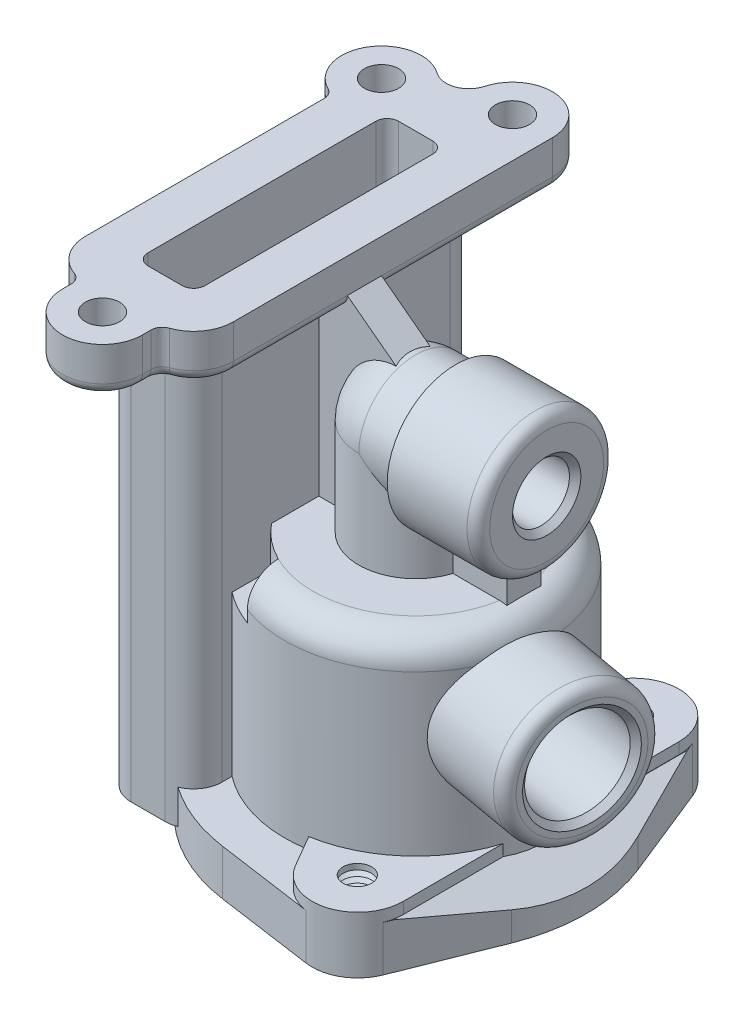
from build123d import *

# Parameters (mm, degrees)
EXTRUDE_1_DEPTH          = 8
EXTRUDE_2_DEPTH          = 2
CUT_EXTRUDE_2_DEPTH      = 86.073807982
CUT_EXTRUDE_2_DEPTH_BACK = 86.073807982
EXTRUDE_3_REACH          = 80.623
EXTRUDE_4_DEPTH          = 80
EXTRUDE_5_DEPTH          = 8
CUT_EXTRUDE_3_DEPTH      = 77
SKETCH_18_R              = 5
CUT_EXTRUDE_4_DEPTH      = 23
CHAMFER_1_SIZE           = 1
SKETCH_19_R              = 8
CUT_EXTRUDE_5_DEPTH      = 36
CHAMFER_2_SIZE           = 1
EXTRUDE_6_DEPTH          = 10
EXTRUDE_6_DEPTH_BACK     = 3
CUT_EXTRUDE_6_DEPTH      = 10
CUT_EXTRUDE_7_DEPTH      = 7
RIB_1_REACH              = 101.619
SKETCH_23_WALL_W         = 211.268706026
SKETCH_23_WALL_H         = 6
RIB_2_REACH              = 101.619
SKETCH_24_WALL_W         = 206.238550486
SKETCH_24_WALL_H         = 6
SKETCH_25_R              = 3
CUT_EXTRUDE_8_DEPTH      = 100.619275243
PATTERN_CIRCULAR_1_COUNT = 3
FILLET_1_R               = 2
FILLET_2_R               = 2
FILLET_10_R              = 5
FILLET_11_R              = 2


with BuildPart() as part:
    # 草圖1 → 伸長1 (new body)
    with BuildSketch(Plane(origin=(0, 0, 0), x_dir=(1, 0, 0), z_dir=(0, 1, 0))):
        with BuildLine():
            Line((-34.294311799, 4.888780854), (-23.603829643, 18.516458252))
            ThreePointArc((-23.603829643, 18.516458252), (-15.045388996, 25.954503847), (-4.337607065, 29.684763178))
            Line((-4.337607065, 29.684763178), (12.800898947, 32.189081785))
            ThreePointArc((12.800898947, 32.189081785), (17.945478211, 31.208329205), (21.380964312, 27.255354796))
            Line((21.380964312, 27.255354796), (27.837638056, 11.183286971))
            ThreePointArc((27.837638056, 11.183286971), (29.999954172, 0.052437157), (27.87656255, -11.085903679))
            Line((27.87656255, -11.085903679), (21.476113077, -27.180444572))
            ThreePointArc((21.476113077, -27.180444572), (18.054466796, -31.145404616), (12.913347487, -32.14413565))
            Line((12.913347487, -32.14413565), (-4.233808413, -29.699745223))
            ThreePointArc((-4.233808413, -29.699745223), (-14.954565176, -26.006941004), (-23.538955485, -18.598859499))
            Line((-23.538955485, -18.598859499), (-34.277012024, -5.008637213))
            ThreePointArc((-34.277012024, -5.008637213), (-35.999945007, -0.062924589), (-34.294311799, 4.888780854))
        make_face()
    extrude(amount=EXTRUDE_1_DEPTH)

    # 草圖2 → 旋轉1 (revolve)
    with BuildSketch(Plane.XY, mode=Mode.PRIVATE) as revolve_1_sk:
        with BuildLine():
            Line((10, 60), (10, 43))
            Line((10, 43), (23, 43))
            Line((23, 43), (23, 0))
            Line((23, 0), (0, 0))
            Line((0, 0), (0, 70))
            ThreePointArc((0, 70), (7.071067812, 67.071067812), (10, 60))
        make_face()
    revolve(revolve_1_sk.sketch.rotate(Axis((0, -12.299634449, 0), (0, 1, 0)), 90), axis=Axis((0, -12.299634449, 0), (0, 1, 0)))

    # 草圖5 → 伸長2 (add)
    with BuildSketch(Plane(origin=(0, 8, 0), x_dir=(-1, 0, 0), z_dir=(0, 1, 0))):
        with BuildLine():
            ThreePointArc((-3.893353697, 22.668078811), (-15.223471322, 17.240821352), (-22.011679547, 6.66977987))
            Line((-22.011679547, 6.66977987), (-21.988228798, -6.746687657))
            ThreePointArc((-21.988228798, -6.746687657), (-15.16310775, -17.293934294), (-3.814086721, -22.681550707))
            Line((-3.814086721, -22.681550707), (9.237590196, 0.016146457))
            Line((9.237590196, 0.016146457), (-3.893353697, 22.668078811))
        make_face()
        with BuildLine():
            ThreePointArc((-3.814086721, -22.681550707), (-15.16310775, -17.293934294), (-21.988228798, -6.746687657))
            Line((-21.988228798, -6.746687657), (-21.957594164, -24.273144937))
            ThreePointArc((-21.957594164, -24.273144937), (-21.81211392, -25.79186789), (-21.380964312, -27.255354796))
            ThreePointArc((-21.380964312, -27.255354796), (-17.945478211, -31.208329205), (-12.800898947, -32.189081785))
            ThreePointArc((-12.800898947, -32.189081785), (-9.460147322, -30.889259499), (-7.022409896, -28.261028984))
            Line((-7.022409896, -28.261028984), (-3.814086721, -22.681550707))
        make_face()
        with BuildLine():
            Line((-22.042363063, 24.224203591), (-22.042314181, 24.196237149))
            Line((-22.042314181, 24.196237149), (-22.011679547, 6.66977987))
            ThreePointArc((-22.011679547, 6.66977987), (-15.223471322, 17.240821352), (-3.893353697, 22.668078811))
            Line((-3.893353697, 22.668078811), (-7.121162037, 28.236307323))
            ThreePointArc((-7.121162037, 28.236307323), (-9.568072349, 30.855999924), (-12.913347487, 32.14413565))
            ThreePointArc((-12.913347487, 32.14413565), (-18.054466796, 31.145404616), (-21.476113077, 27.180444572))
            ThreePointArc((-21.476113077, 27.180444572), (-21.899525404, 25.729195267), (-22.042363063, 24.224203591))
        make_face()
    extrude(amount=EXTRUDE_2_DEPTH)

    # 草圖6 → 除料-伸長2 (cut, two sides: drawn at the far end of the back side and taken through both)
    with BuildSketch(Plane.XY.offset(-CUT_EXTRUDE_2_DEPTH_BACK)):
        Polygon((22.011679547, 8), (30, 4), (30, 8), align=None)
    extrude(amount=CUT_EXTRUDE_2_DEPTH + CUT_EXTRUDE_2_DEPTH_BACK, mode=Mode.SUBTRACT)

    # 草圖7 → 伸長3 (add, up to next)
    with BuildSketch(Plane.XZ.offset(-8), mode=Mode.PRIVATE) as extrude_3_sk1:
        with BuildLine():
            Line((22.011679547, 6.66977987), (22.011679547, -6.66977987))
            ThreePointArc((22.011679547, -6.66977987), (23, 0), (22.011679547, 6.66977987))
        make_face()
    extrude_3_tool1 = extrude(extrude_3_sk1.sketch, amount=EXTRUDE_3_REACH, mode=Mode.PRIVATE) - part.part
    add(extrude_3_tool1.solids().sort_by_distance((22.407745, 8, 0))[0])

    # 草圖8 → 旋轉2 (revolve)
    with BuildSketch(Plane.XY, mode=Mode.PRIVATE) as revolve_2_sk:
        Polygon((0, 60), (0, 70), (7, 70), (7, 72), (23, 72), (23, 60), (7, 60), align=None)
    revolve(revolve_2_sk.sketch.rotate(Axis((0, 60, 0), (1, 0, 0)), 90), axis=Axis((0, 60, 0), (1, 0, 0)))

    # 草圖9 → 旋轉3 (revolve)
    with BuildSketch(Plane(origin=(0, 28, 0), x_dir=(-1, 0, 0), z_dir=(0, 1, 0))):
        Polygon((-33.369300976, 18.069027432), (-35.453079108, 6.251334396), (0, 0), (2.083778132, 11.817693036), align=None)
    revolve(axis=Axis((0, 28, 0), (0.984807753012208, 0, 0.17364817766693058)))

    # 草圖10 → 伸長4 (add)
    with BuildSketch(Plane(origin=(0, 82, 0), x_dir=(-1, 0, 0), z_dir=(0, 1, 0))):
        with BuildLine():
            Line((25, -25), (19, -25))
            ThreePointArc((19, -25), (15.464466094, -23.535533906), (14, -20))
            Line((14, -20), (14, 20))
            ThreePointArc((14, 20), (15.464466094, 23.535533906), (19, 25))
            Line((19, 25), (25, 25))
            ThreePointArc((25, 25), (28.535533906, 23.535533906), (30, 20))
            Line((30, 20), (30, -20))
            ThreePointArc((30, -20), (28.535533906, -23.535533906), (25, -25))
        make_face()
    extrude(amount=-EXTRUDE_4_DEPTH)

    # 草圖11 → 伸長5 (add)
    with BuildSketch(Plane(origin=(0, 82, 0), x_dir=(-1, 0, 0), z_dir=(0, 1, 0))):
        with BuildLine():
            Line((9, -33), (9, 23))
            ThreePointArc((9, 23), (10.284523934, 27.041451884), (13.666666667, 29.599663291))
            ThreePointArc((13.666666667, 29.599663291), (14.632993162, 30.330580836), (15, 31.485281374))
            Line((15, 31.485281374), (15, 33))
            ThreePointArc((15, 33), (22, 40), (29, 33))
            Line((29, 33), (29, 31.485281374))
            ThreePointArc((29, 31.485281374), (29.367006838, 30.330580836), (30.333333333, 29.599663291))
            ThreePointArc((30.333333333, 29.599663291), (33.715476066, 27.041451884), (35, 23))
            Line((35, 23), (35, -18.937742252))
            ThreePointArc((35, -18.937742252), (35.300326829, -19.991834805), (36.111111111, -20.729355085))
            ThreePointArc((36.111111111, -20.729355085), (39.000898161, -30.604056223), (28.926223364, -32.69248135))
            ThreePointArc((28.926223364, -32.69248135), (25.26707053, -32.173366502), (22.744405182, -34.874299532))
            ThreePointArc((22.744405182, -34.874299532), (15.054176622, -39.935806957), (9, -33))
        make_face()
    extrude(amount=-EXTRUDE_5_DEPTH)

    # 草圖12 → 除料-伸長3 (cut)
    with BuildSketch(Plane(origin=(0, 82, 0), x_dir=(-1, 0, 0), z_dir=(0, 1, 0))):
        with BuildLine():
            Line((27, -20), (27, 20))
            ThreePointArc((27, 20), (26.414213562, 21.414213562), (25, 22))
            Line((25, 22), (19, 22))
            ThreePointArc((19, 22), (17.585786438, 21.414213562), (17, 20))
            Line((17, 20), (17, -20))
            ThreePointArc((17, -20), (17.585786438, -21.414213562), (19, -22))
            Line((19, -22), (25, -22))
            ThreePointArc((25, -22), (26.414213562, -21.414213562), (27, -20))
        make_face()
    extrude(amount=-CUT_EXTRUDE_3_DEPTH, mode=Mode.SUBTRACT)

    # 草圖15 → 旋轉4 (revolve)
    with BuildSketch(Plane.XY):
        with BuildLine():
            Line((-35.999957228, 8), (-35.999957228, 0))
            Line((-35.999957228, 0), (-27.999957228, 0))
            Line((-27.999957228, 0), (-27.999957228, 18))
            ThreePointArc((-27.999957228, 18), (-33.656811477, 15.656854249), (-35.999957228, 10))
            Line((-35.999957228, 10), (-35.999957228, 8))
        make_face()
    revolve(axis=Axis((-27.999957228, 10, 0), (0, -1, 0)))

    # 草圖16 → 除料-旋轉2 (revolve, cut)
    with BuildSketch(Plane.XY, mode=Mode.PRIVATE) as cut_revolve_2_sk:
        with BuildLine():
            Line((7, 60), (7, 40))
            Line((7, 40), (20, 40))
            Line((20, 40), (20, 1))
            Line((20, 1), (24, 1))
            Line((24, 1), (24, 0))
            Line((24, 0), (0, 0))
            Line((0, 0), (0, 67))
            ThreePointArc((0, 67), (4.949747468, 64.949747468), (7, 60))
        make_face()
    revolve(cut_revolve_2_sk.sketch.rotate(Axis((0, -12.093798165, 0), (0, 1, 0)), 90), axis=Axis((0, -12.093798165, 0), (0, 1, 0)), mode=Mode.SUBTRACT)

    # 草圖18 → 除料-伸長4 (cut)
    with BuildSketch(Plane(origin=(23, 0, 0), x_dir=(0, 0, -1), z_dir=(1, 0, 0))):
        with Locations((0, 60)):
            Circle(SKETCH_18_R)
    extrude(amount=-CUT_EXTRUDE_4_DEPTH, mode=Mode.SUBTRACT)

    # 導角1
    chamfer_1_edges = [part.edges().sort_by_distance(p)[0] for p in [
        (23, 60, 5),
    ]]
    chamfer(chamfer_1_edges, length=CHAMFER_1_SIZE)

    # 草圖19 → 除料-伸長5 (cut)
    with BuildSketch(Plane(origin=(35.453079108, 0, 6.251334396), x_dir=(0.17364817766693064, 0, -0.9848077530122081), z_dir=(0.9848077530122081, 0, 0.17364817766693064))):
        with Locations((0, 28)):
            Circle(SKETCH_19_R)
    extrude(amount=-CUT_EXTRUDE_5_DEPTH, mode=Mode.SUBTRACT)

    # 導角2
    chamfer_2_edges = [part.edges().sort_by_distance(p)[0] for p in [
        (34.063893687, 28, 14.12979642),
    ]]
    chamfer(chamfer_2_edges, length=CHAMFER_2_SIZE)

    # 草圖20 → 伸長6 (add, two sides: drawn at the far end of the back side and taken through both)
    with BuildSketch(Plane.XZ.offset(-40).offset(-EXTRUDE_6_DEPTH_BACK)):
        with BuildLine():
            Line((-6, 19.078784028), (-6, 13.747727085))
            ThreePointArc((-6, 13.747727085), (-15, 0), (-6, -13.747727085))
            Line((-6, -13.747727085), (-6, -19.078784028))
            ThreePointArc((-6, -19.078784028), (-20, 0), (-6, 19.078784028))
        make_face()
    extrude(amount=EXTRUDE_6_DEPTH + EXTRUDE_6_DEPTH_BACK)

    # 草圖21 → 除料-伸長6 (cut)
    with BuildSketch(Plane(origin=(0, 43, 0), x_dir=(-1, 0, 0), z_dir=(0, 1, 0))):
        with BuildLine():
            Line((17, 10.535653753), (17, 5.916079783))
            ThreePointArc((17, 5.916079783), (18, 0), (17, -5.916079783))
            Line((17, -5.916079783), (17, -10.535653753))
            ThreePointArc((17, -10.535653753), (20, 0), (17, 10.535653753))
        make_face()
    extrude(amount=-CUT_EXTRUDE_6_DEPTH, mode=Mode.SUBTRACT)

    # 草圖22 → 除料-伸長7 (cut)
    with BuildSketch(Plane(origin=(0, 43, 0), x_dir=(-1, 0, 0), z_dir=(0, 1, 0))):
        with BuildLine():
            Line((14, 18.248287591), (14, 11.313708499))
            ThreePointArc((14, 11.313708499), (11.259927442, 14.043291424), (8, 16.124515497))
            Line((8, 16.124515497), (8, 21.563858653))
            ThreePointArc((8, 21.563858653), (11.124219203, 20.130865534), (14, 18.248287591))
        make_face()
        with BuildLine():
            Line((8, -21.563858653), (8, -16.124515497))
            ThreePointArc((8, -16.124515497), (11.259927442, -14.043291424), (14, -11.313708499))
            Line((14, -11.313708499), (14, -18.248287591))
            ThreePointArc((14, -18.248287591), (11.124219203, -20.130865534), (8, -21.563858653))
        make_face()
    extrude(amount=-CUT_EXTRUDE_7_DEPTH, mode=Mode.SUBTRACT)

    # 草圖23 wall → 肋材1 (add, up to next)
    with BuildSketch(Plane(origin=(-5, 72.974937186, 0), x_dir=(0.7975948099, -0.603193600116, 0), z_dir=(0.603193600116, 0.7975948099, 0)), mode=Mode.PRIVATE) as rib_1_sk1:
        Rectangle(SKETCH_23_WALL_W, SKETCH_23_WALL_H)
    rib_1_tool1 = extrude(rib_1_sk1.sketch, amount=-RIB_1_REACH, mode=Mode.PRIVATE) - part.part
    add(rib_1_tool1.solids().sort_by_distance((-5, 72.974937186, 0))[0])

    # 草圖24 wall → 肋材2 (add, up to next)
    with BuildSketch(Plane(origin=(19, 45.5, 0), x_dir=(0, -1, 0), z_dir=(1, 0, 0)), mode=Mode.PRIVATE) as rib_2_sk1:
        Rectangle(SKETCH_24_WALL_W, SKETCH_24_WALL_H)
    rib_2_tool1 = extrude(rib_2_sk1.sketch, amount=-RIB_2_REACH, mode=Mode.PRIVATE) - part.part
    add(rib_2_tool1.solids().sort_by_distance((19, 45.5, 0))[0])

    # 草圖25 → 除料-伸長8 (cut, through all)
    with BuildSketch(Plane(origin=(0, 82, 0), x_dir=(-1, 0, 0), z_dir=(0, 1, 0))):
        with Locations(Location((16, -33, 0), (0, 0, 90))):
            Circle(SKETCH_25_R)
        with Locations(Location((33, -27, 0), (0, 0, 90))):
            Circle(SKETCH_25_R)
        with Locations(Location((22, 33, 0), (0, 0, 90))):
            Circle(SKETCH_25_R)
    extrude(amount=-CUT_EXTRUDE_8_DEPTH, mode=Mode.SUBTRACT)

    # 草圖26 → 除料-旋轉3 (revolve, cut)
    with BuildSketch(Plane.XY, mode=Mode.PRIVATE) as cut_revolve_3_sk:
        Polygon((-30.499957228, 0), (-31.365982631, 0.5), (-30.499957228, 1), (-31.365982631, 1.5), (-30.499957228, 2), (-31.365982631, 2.5), (-30.499957228, 3), (-31.365982631, 3.5), (-30.499957228, 4), (-31.365982631, 4.5), (-30.499957228, 5), (-31.365982631, 5.5), (-30.499957228, 6), (-31.365982631, 6.5), (-30.499957228, 7), (-31.365982631, 7.5), (-30.499957228, 8), (-31.365982631, 8.5), (-30.499957228, 9), (-30.499957228, 12), (-27.999957228, 13.443375673), (-27.999957228, 0), align=None)
    cut_revolve_3 = revolve(cut_revolve_3_sk.sketch.rotate(Axis((-27.999957228, 19.582075994, 0), (0, -1, 0)), 270), axis=Axis((-27.999957228, 19.582075994, 0), (0, -1, 0)), mode=Mode.SUBTRACT)

    # 環狀複製排列1: 除料-旋轉3 ×3 about axis
    pattern_circular_1_axis = Axis((0, 0, 0), (0, 1, 0))
    for i in range(1, PATTERN_CIRCULAR_1_COUNT):
        add(cut_revolve_3.rotate(pattern_circular_1_axis, i * 360 / PATTERN_CIRCULAR_1_COUNT), mode=Mode.SUBTRACT)

    # 圓角1
    fillet_1_edges = [part.edges().sort_by_distance(p)[0] for p in [
        (23, 60, -12),
    ]]
    fillet(fillet_1_edges, radius=FILLET_1_R)

    # 圓角2
    fillet_2_edges = [part.edges().sort_by_distance(p)[0] for p in [
        (37.53685724, 28, -5.56635864),
    ]]
    fillet(fillet_2_edges, radius=FILLET_2_R)

    # 圓角10
    # the kernel refuses this fillet: 5 mm, written as the material it takes off along each edge
    with BuildSketch(Plane(origin=(0, 43, 0), x_dir=(-0.7832105432631083, 0, 0.621756580119187), z_dir=(-0.621756580119187, 0, -0.7832105432631083))) as fillet_10_piece_1_section:
        with BuildLine():
            CenterArc((23 - FILLET_10_R, -FILLET_10_R), FILLET_10_R, 0, 90)
            Line((23 - FILLET_10_R, 0), (23, 0))
            Line((23, 0), (23, -FILLET_10_R))
        make_face()
    fillet_10_piece_1 = revolve(axis=Axis((0, 43, 0), (0, 1, 0)), revolution_arc=231.555476966, mode=Mode.PRIVATE)
    fillet_10_piece_1 = split(fillet_10_piece_1, bisect_by=Plane(origin=(-14, 41.57977262, 20.845930226), z_dir=(1, 0, 0)), keep=Keep.TOP, mode=Mode.PRIVATE)
    fillet_10_piece_1 = split(fillet_10_piece_1, bisect_by=Plane(origin=(5.579765171, 41.57977262, 3), z_dir=(0, 0, 1)), keep=Keep.TOP, mode=Mode.PRIVATE)
    fillet_10_piece_1 = split(fillet_10_piece_1, bisect_by=Plane(origin=(19, 41.57977262, 20.845930226), z_dir=(-1, 0, 0)), keep=Keep.TOP, mode=Mode.PRIVATE)
    add(fillet_10_piece_1, mode=Mode.SUBTRACT)
    with BuildSketch(Plane(origin=(0, 43, 0), x_dir=(-0.7832105432631083, 0, 0.621756580119187), z_dir=(-0.621756580119187, 0, -0.7832105432631083))) as fillet_10_piece_2_section:
        with BuildLine():
            CenterArc((23 - FILLET_10_R, -FILLET_10_R), FILLET_10_R, 0, 90)
            Line((23 - FILLET_10_R, 0), (23, 0))
            Line((23, 0), (23, -FILLET_10_R))
        make_face()
    fillet_10_piece_2 = revolve(axis=Axis((0, 43, 0), (0, 1, 0)), revolution_arc=231.555476966, mode=Mode.PRIVATE)
    fillet_10_piece_2 = fillet_10_piece_2 - Plane(origin=(21.382106569, 28, 3.770242293), x_dir=(-0.17364817766693058, 0, 0.984807753012208), z_dir=(0.984807753012208, 0, 0.17364817766693058)) * Cylinder(12, 92, mode=Mode.PRIVATE)
    fillet_10_piece_2 = split(fillet_10_piece_2, bisect_by=Plane(origin=(20.741195984, 41.778142851, 3), z_dir=(0, 0, 1)), keep=Keep.TOP, mode=Mode.PRIVATE)
    fillet_10_piece_2 = split(fillet_10_piece_2, bisect_by=Plane(origin=(19, 41.778142851, 7.405026841), z_dir=(1, 0, 0)), keep=Keep.TOP, mode=Mode.PRIVATE)
    add(fillet_10_piece_2, mode=Mode.SUBTRACT)
    with BuildSketch(Plane(origin=(0, 43, 0), x_dir=(-0.7832105432631083, 0, 0.621756580119187), z_dir=(-0.621756580119187, 0, -0.7832105432631083))) as fillet_10_piece_3_section:
        with BuildLine():
            CenterArc((23 - FILLET_10_R, -FILLET_10_R), FILLET_10_R, 0, 90)
            Line((23 - FILLET_10_R, 0), (23, 0))
            Line((23, 0), (23, -FILLET_10_R))
        make_face()
    fillet_10_piece_3 = revolve(axis=Axis((0, 43, 0), (0, 1, 0)), revolution_arc=231.555476966, mode=Mode.PRIVATE)
    fillet_10_piece_3 = split(fillet_10_piece_3, bisect_by=Plane(origin=(19, 41.572928891, -16.400836557), z_dir=(-1, 0, 0)), keep=Keep.TOP, mode=Mode.PRIVATE)
    fillet_10_piece_3 = split(fillet_10_piece_3, bisect_by=Plane(origin=(14.014414764, 41.572928891, -3), z_dir=(0, 0, -1)), keep=Keep.TOP, mode=Mode.PRIVATE)
    add(fillet_10_piece_3, mode=Mode.SUBTRACT)
    with BuildSketch(Plane(origin=(0, 43, 0), x_dir=(-0.7832105432631083, 0, 0.621756580119187), z_dir=(-0.621756580119187, 0, -0.7832105432631083))) as fillet_10_piece_4_section:
        with BuildLine():
            CenterArc((23 - FILLET_10_R, -FILLET_10_R), FILLET_10_R, 0, 90)
            Line((23 - FILLET_10_R, 0), (23, 0))
            Line((23, 0), (23, -FILLET_10_R))
        make_face()
    fillet_10_piece_4 = revolve(axis=Axis((0, 43, 0), (0, 1, 0)), revolution_arc=231.555476966, mode=Mode.PRIVATE)
    fillet_10_piece_4 = fillet_10_piece_4 - Plane(origin=(21.174498314, 28, 3.733635356), x_dir=(-0.17364817766693058, 0, 0.984807753012208), z_dir=(0.984807753012208, 0, 0.17364817766693058)) * Cylinder(12, 92, mode=Mode.PRIVATE)
    fillet_10_piece_4 = split(fillet_10_piece_4, bisect_by=Plane(origin=(21.84029198, 41.942478742, 3), z_dir=(0, 0, -1)), keep=Keep.TOP, mode=Mode.PRIVATE)
    fillet_10_piece_4 = split(fillet_10_piece_4, bisect_by=Plane(origin=(19, 41.942478742, -0.042268155), z_dir=(1, 0, 0)), keep=Keep.TOP, mode=Mode.PRIVATE)
    fillet_10_piece_4 = split(fillet_10_piece_4, bisect_by=Plane(origin=(21.84029198, 41.942478742, -3), z_dir=(0, 0, 1)), keep=Keep.TOP, mode=Mode.PRIVATE)
    add(fillet_10_piece_4, mode=Mode.SUBTRACT)
    with BuildSketch(Plane(origin=(0, 43, 0), x_dir=(-0.7832105432631083, 0, 0.621756580119187), z_dir=(-0.621756580119187, 0, -0.7832105432631083))) as fillet_10_piece_5_section:
        with BuildLine():
            CenterArc((23 - FILLET_10_R, -FILLET_10_R), FILLET_10_R, 0, 90)
            Line((23 - FILLET_10_R, 0), (23, 0))
            Line((23, 0), (23, -FILLET_10_R))
        make_face()
    fillet_10_piece_5 = revolve(axis=Axis((0, 43, 0), (0, 1, 0)), revolution_arc=231.555476966, mode=Mode.PRIVATE)
    fillet_10_piece_5 = split(fillet_10_piece_5, bisect_by=Plane(origin=(19, 41.663526658, -7.326847303), z_dir=(1, 0, 0)), keep=Keep.TOP, mode=Mode.PRIVATE)
    fillet_10_piece_5 = split(fillet_10_piece_5, bisect_by=Plane(origin=(20.804436883, 41.663526658, -3), z_dir=(0, 0, -1)), keep=Keep.TOP, mode=Mode.PRIVATE)
    add(fillet_10_piece_5, mode=Mode.SUBTRACT)
    with BuildSketch(Plane(origin=(0, 43, 0), x_dir=(0, 0, -1), z_dir=(1, 0, 0))) as fillet_10_piece_6_section:
        with BuildLine():
            CenterArc((23 - FILLET_10_R, -FILLET_10_R), FILLET_10_R, 0, 90)
            Line((23 - FILLET_10_R, 0), (23, 0))
            Line((23, 0), (23, -FILLET_10_R))
        make_face()
    fillet_10_piece_6 = revolve(axis=Axis((0, 43, 0), (0, 1, 0)), revolution_arc=51.494056637, mode=Mode.PRIVATE)
    fillet_10_piece_6 = split(fillet_10_piece_6, bisect_by=Plane(origin=(-14, 41.874920734, -20.126995921), z_dir=(1, 0, 0)), keep=Keep.TOP, mode=Mode.PRIVATE)
    add(fillet_10_piece_6, mode=Mode.SUBTRACT)

    # 圓角11
    fillet_11_edges = [part.edges().sort_by_distance(p)[0] for p in [
        (-9, 74, -18),
        (-15.054176622, 74, -39.935806957),
        (-25.26707053, 74, -32.173366502),
        (-39.000898161, 74, -30.604056223),
        (-35.300326829, 74, -19.991834805),
        (-35, 74, 2.031128874),
        (-33.715476066, 74, 27.041451884),
        (-29.367006838, 74, 30.330580836),
        (-29, 74, 32.242640687),
        (-9, 74, 13),
        (-10.284523934, 74, 27.041451884),
        (-14.632993162, 74, 30.330580836),
        (-15, 74, 32.242640687),
        (-22, 74, 40),
    ]]
    fillet(fillet_11_edges, radius=FILLET_11_R)


solid = part.part
